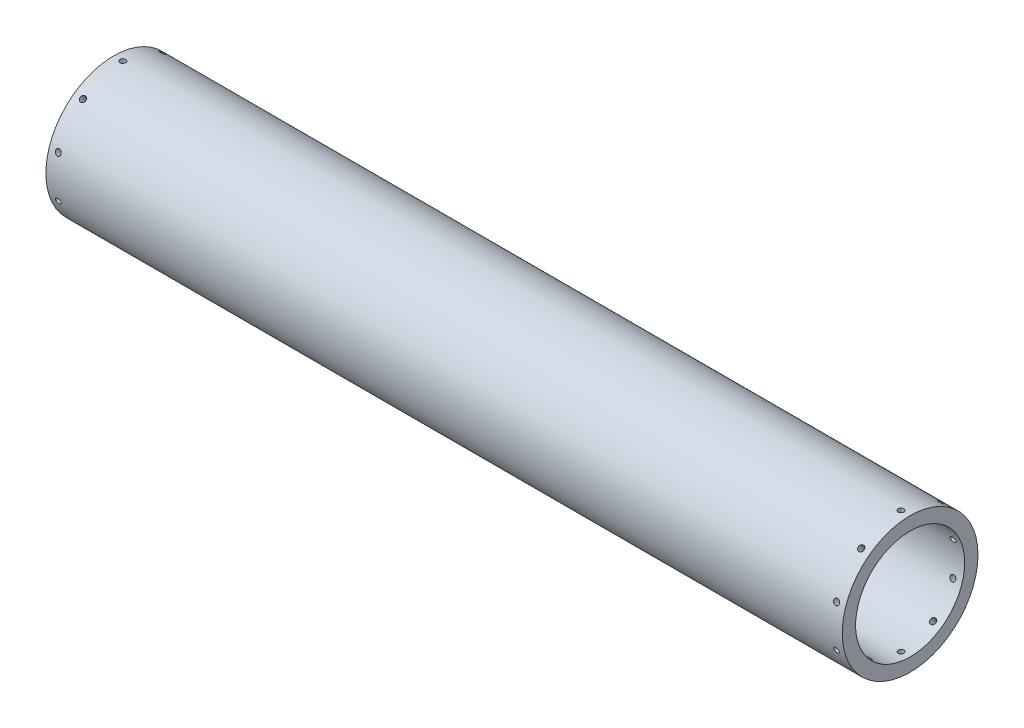
from build123d import *

# Parameters (mm, degrees)
SKETCH1_R           = 57.15
SKETCH1_R_2         = 45.9486
BOSS_EXTRUDE1_DEPTH = 670.56
SKETCH6_R           = 2.413
CUT_EXTRUDE1_DEPTH  = 15.24
SKETCH7_R           = 2.413
CUT_EXTRUDE2_DEPTH  = 15.24
CIRPATTERN2_COUNT   = 10
CIRPATTERN3_COUNT   = 10


with BuildPart() as part:
    # Sketch1 → Boss-Extrude1 (new body)
    with BuildSketch(Plane(origin=(0, 0, 0), x_dir=(0, 0, -1), z_dir=(1, 0, 0))):
        Circle(SKETCH1_R)
        Circle(SKETCH1_R_2, mode=Mode.SUBTRACT)
    extrude(amount=BOSS_EXTRUDE1_DEPTH)

    # Sketch6 → Cut-Extrude1 (cut)
    with BuildSketch(Plane(origin=(0, 57.15, 0), x_dir=(1, 0, 0), z_dir=(0, 1, 0))):
        with Locations((7.62, 0)):
            Circle(SKETCH6_R)
    cut_extrude1 = extrude(amount=-CUT_EXTRUDE1_DEPTH, mode=Mode.SUBTRACT)

    # Sketch7 → Cut-Extrude2 (cut)
    with BuildSketch(Plane(origin=(0, 57.15, 0), x_dir=(1, 0, 0), z_dir=(0, 1, 0))):
        with Locations((662.94, 0)):
            Circle(SKETCH7_R)
    cut_extrude2 = extrude(amount=-CUT_EXTRUDE2_DEPTH, mode=Mode.SUBTRACT)

    # CirPattern2: Cut-Extrude2 ×10 about axis
    cirpattern2_axis = Axis((670.56, 0, 0), (1, 0, 0))
    for i in range(1, CIRPATTERN2_COUNT):
        add(cut_extrude2.rotate(cirpattern2_axis, i * 360 / CIRPATTERN2_COUNT), mode=Mode.SUBTRACT)

    # CirPattern3: Cut-Extrude1 ×10 about axis
    cirpattern3_axis = Axis((0, 0, 0), (-1, 0, 0))
    for i in range(1, CIRPATTERN3_COUNT):
        add(cut_extrude1.rotate(cirpattern3_axis, i * 360 / CIRPATTERN3_COUNT), mode=Mode.SUBTRACT)


solid = part.part
